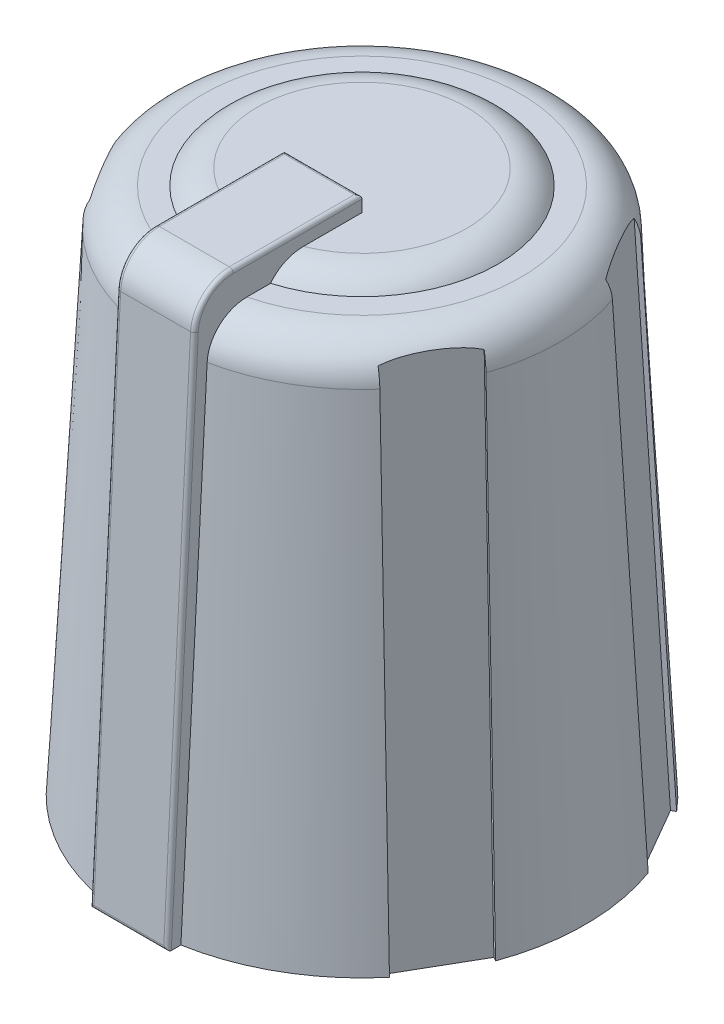
from build123d import *

# Parameters (mm, degrees)
SKETCH1_R                = 5.75
BOSS_EXTRUDE1_DEPTH      = 14
BOSS_EXTRUDE1_TAPER      = 3
SKETCH2_OUTSIDE_W        = 17.792
SKETCH2_OUTSIDE_H        = 17.792
SKETCH2_OUTSIDE_R        = 3.5
CUT_EXTRUDE1_DEPTH       = 0.4
FILLET2_R                = 1
FILLET3_R                = 1
CUT_EXTRUDE2_DEPTH       = 1
CIRPATTERN1_COUNT        = 6
BOSS_EXTRUDE2_DEPTH      = 1
BOSS_EXTRUDE2_DEPTH_BACK = 1
FILLET4_R                = 1
FILLET5_R                = 0.1
CUT_EXTRUDE3_DEPTH       = 10


with BuildPart() as part:
    # Sketch1 → Boss-Extrude1 (new body)
    with BuildSketch(Plane(origin=(0, 0, 0), x_dir=(1, 0, 0), z_dir=(0, 1, 0))):
        Circle(SKETCH1_R)
    extrude(amount=BOSS_EXTRUDE1_DEPTH, taper=BOSS_EXTRUDE1_TAPER)

    # Sketch2 outside → Cut-Extrude1 (cut)
    with BuildSketch(Plane(origin=(0, 14, 0), x_dir=(1, 0, 0), z_dir=(0, 1, 0))):
        Rectangle(SKETCH2_OUTSIDE_W, SKETCH2_OUTSIDE_H)
        with Locations(Location((0, 0, 0), (0, 0, 270))):
            Circle(SKETCH2_OUTSIDE_R, mode=Mode.SUBTRACT)
    extrude(amount=-CUT_EXTRUDE1_DEPTH, mode=Mode.SUBTRACT)

    # Fillet2
    # the kernel refuses this fillet: 1 mm, written as the material it takes off along each edge
    with BuildSketch(Plane(origin=(0, 14, 0), x_dir=(0, 0, 1), z_dir=(-1, 0, 0))) as fillet2_piece_1:
        with BuildLine():
            CenterArc((2.7, -1), FILLET2_R, 36.869897646, 53.130102354)
            Line((2.7, 0), (2.7, 0.02))
            Line((2.7, 0.02), (3.5, 0.02))
            Line((3.5, 0.02), (3.52, 0))
            ThreePointArc((3.52, 0), (3.52, -0.2), (3.516, -0.388))
            Line((3.516, -0.388), (3.5, -0.4))
        make_face()
    revolve(axis=Axis((0, 14, 0), (0, 1, 0)), mode=Mode.SUBTRACT)

    # Fillet3
    fillet3_edges = [part.edges().sort_by_distance(p)[0] for p in [
        (-5.037254202, 13.6, 0),
    ]]
    fillet(fillet3_edges, radius=FILLET3_R)

    # Sketch3 → Cut-Extrude2 (cut, symmetric)
    with BuildSketch(Plane(origin=(0, 0, 0), x_dir=(0, 0, -1), z_dir=(1, 0, 0))):
        Polygon((-6.905330432, 14.229180533), (-4.800601017, 14.229180533), (-5.581491189, -0.671091575), (-7.885175425, -0.671091575), align=None)
    cut_extrude2 = extrude(amount=CUT_EXTRUDE2_DEPTH, both=True, mode=Mode.SUBTRACT)

    # CirPattern1: Cut-Extrude2 ×6 about axis
    cirpattern1_axis = Axis((0, 0, 0), (0, 1, 0))
    for i in range(1, CIRPATTERN1_COUNT):
        add(cut_extrude2.rotate(cirpattern1_axis, i * 360 / CIRPATTERN1_COUNT), mode=Mode.SUBTRACT)

    # Sketch5 → Boss-Extrude2 (add, two sides: drawn at the far end of the back side and taken through both)
    with BuildSketch(Plane(origin=(0, 0, 0), x_dir=(0, 0, -1), z_dir=(1, 0, 0)).offset(-BOSS_EXTRUDE2_DEPTH_BACK)):
        Polygon((-5.265563969, 0), (-4.679794572, 13.176067739), (-1, 13.176067739), (-1, 14.4), (-5.265563969, 14.4), (-6.009500485, 0), align=None)
    extrude(amount=BOSS_EXTRUDE2_DEPTH + BOSS_EXTRUDE2_DEPTH_BACK)

    # Fillet4
    fillet4_edges = [part.edges().sort_by_distance(p)[0] for p in [
        (0, 14.4, 5.265563969),
    ]]
    fillet(fillet4_edges, radius=FILLET4_R)

    # Fillet5
    fillet5_edges = [part.edges().sort_by_distance(p)[0] for p in [
        (0, 0, 6.009500485),
        (-1, 14.4, 2.657946311),
        (0, 14.4, 1),
        (1, 14.4, 2.657946311),
        (1, 6.725796726, 5.662030639),
        (1, 14.125118422, 5.004516811),
        (-1, 6.725796726, 5.662030639),
        (-1, 14.125118422, 5.004516811),
    ]]
    fillet(fillet5_edges, radius=FILLET5_R)

    # Sketch6 → Cut-Extrude3 (cut)
    with BuildSketch(Plane.XZ):
        with BuildLine():
            Line((-1.5, 2.598076211), (-1.5, -2.598076211))
            ThreePointArc((-1.5, -2.598076211), (3, 0), (-1.5, 2.598076211))
        make_face()
    extrude(amount=-CUT_EXTRUDE3_DEPTH, mode=Mode.SUBTRACT)


solid = part.part
